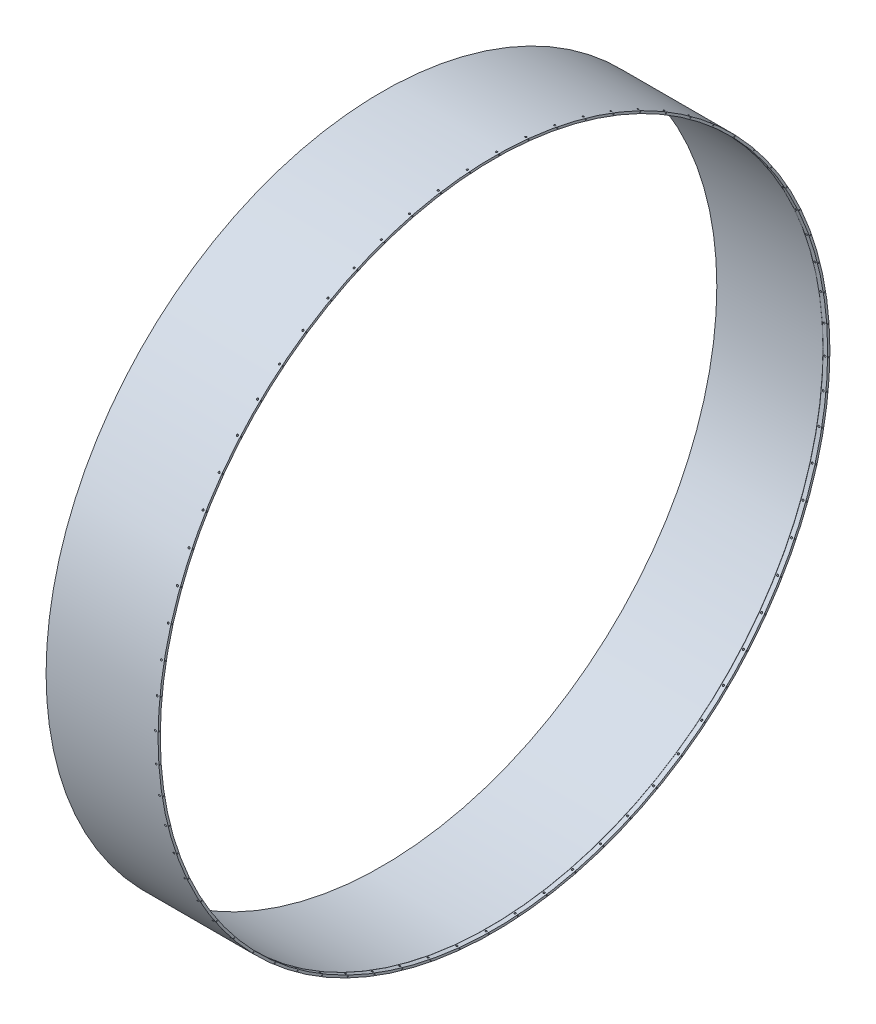
from build123d import *

# Parameters (mm, degrees)
HOLE_WIZARD_1_D          = 8
HOLE_WIZARD_1_DEPTH      = 100
HOLE_WIZARD_2_REACH      = 2181.449
HOLE_WIZARD_2_BORE_R     = 2.5
PATTERN_CIRCULAR_1_COUNT = 72


with BuildPart() as part:
    # Эскиз1 → Повернуть1 (revolve)
    with BuildSketch(Plane.XY):
        with BuildLine():
            Line((0, -1500), (500, -1500))
            Line((500, -1500), (500, -1490))
            Line((500, -1490), (480, -1490))
            ThreePointArc((480, -1490), (478.232233047, -1490.732233047), (477.5, -1492.5))
            ThreePointArc((477.5, -1492.5), (476.767766953, -1494.267766953), (475, -1495))
            Line((475, -1495), (0, -1495))
            Line((0, -1495), (0, -1500))
        make_face()
    revolve(axis=Axis((0, 0, 0), (1, 0, 0)))

    # Отверстие1
    with Locations(Plane(origin=(488, 879.576827513, 1215.049218963), x_dir=(0, 0.810032812642, -0.586384551676), z_dir=(0, 0.586384551676, 0.810032812642))):
        with Locations((1e-09, 0)):
            hole_wizard_1 = Hole(HOLE_WIZARD_1_D / 2, depth=HOLE_WIZARD_1_DEPTH)

    # Отверстие2 bore → Отверстие2 (cut, up to next)
    with BuildSketch(Plane(origin=(500, 0, 0), x_dir=(0, 0, -1), z_dir=(1, 0, 0)), mode=Mode.PRIVATE) as hole_wizard_2_sk1:
        with Locations((-1210.999054899, 876.644904755)):
            Circle(HOLE_WIZARD_2_BORE_R)
    hole_wizard_2_tool1 = extrude(hole_wizard_2_sk1.sketch, amount=-HOLE_WIZARD_2_REACH, mode=Mode.PRIVATE) & part.part
    hole_wizard_2 = hole_wizard_2_tool1.solids().sort_by_distance((500, 876.644905, 1210.999055))[0]
    add(hole_wizard_2, mode=Mode.SUBTRACT)

    # Круговой массив1: Отверстие1, Отверстие2 ×72 about axis
    pattern_circular_1_axis = Axis((0, 0, 0), (1, 0, 0))
    add([hole_wizard_1.rotate(pattern_circular_1_axis, i * 360 / PATTERN_CIRCULAR_1_COUNT) for i in range(1, PATTERN_CIRCULAR_1_COUNT)], mode=Mode.SUBTRACT)
    add([hole_wizard_2.rotate(pattern_circular_1_axis, i * 360 / PATTERN_CIRCULAR_1_COUNT) for i in range(1, PATTERN_CIRCULAR_1_COUNT)], mode=Mode.SUBTRACT)


solid = part.part
